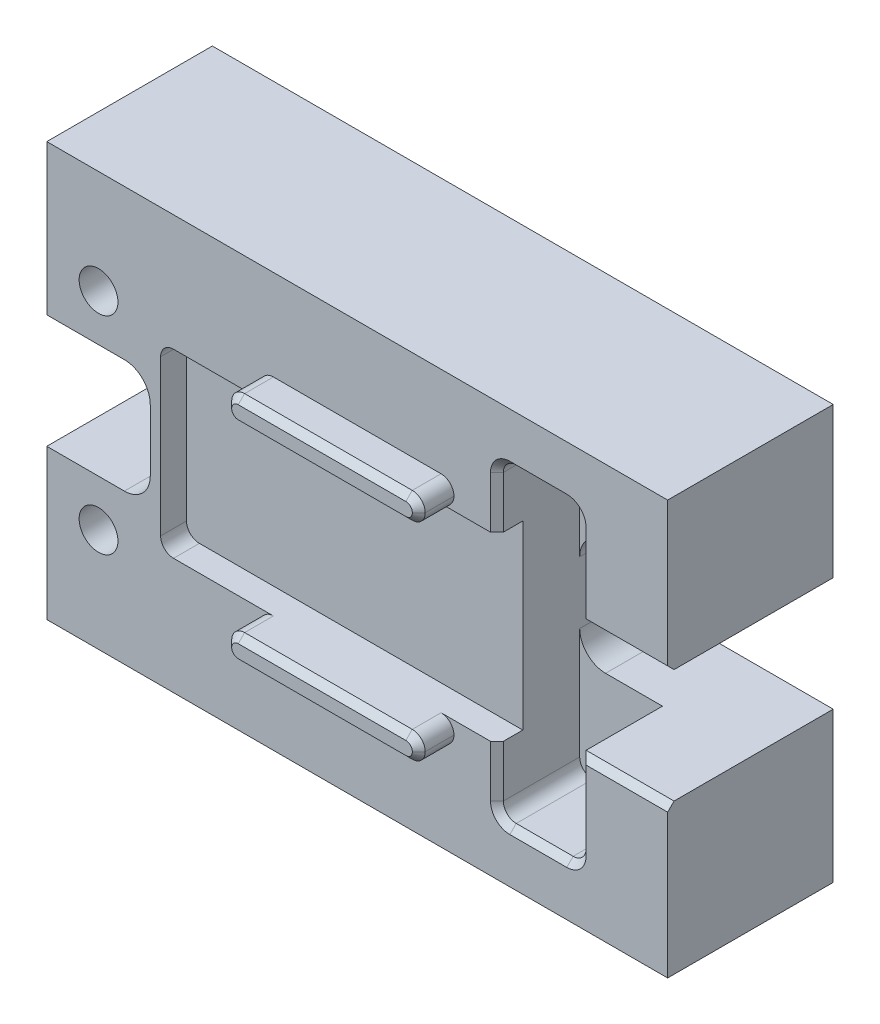
from build123d import *

# Parameters (mm, degrees)
SKETCH1_W           = 50.8
SKETCH1_H           = 76.2
BOSS_EXTRUDE1_DEPTH = 13.97
SKETCH2_W           = 76.2
SKETCH2_H           = 50.8
BOSS_EXTRUDE2_DEPTH = 6.35
CUT_EXTRUDE1_DEPTH  = 10.16
SKETCH4_W           = 12.7
SKETCH4_H           = 13.97
SKETCH4_W_2         = 20.955
CUT_EXTRUDE2_DEPTH  = 51.096630625
SKETCH8_R           = 2.38125
CUT_EXTRUDE4_DEPTH  = 51.096630625
SKETCH10_W          = 23.749
SKETCH10_H          = 3.175
BOSS_EXTRUDE4_DEPTH = 4.318
SKETCH11_W          = 41.275
SKETCH11_H          = 22.225
CUT_EXTRUDE5_DEPTH  = 3.175
FILLET2_R           = 3.175
FILLET3_R           = 1.5875
CHAMFER3_SIZE       = 0.7874


with BuildPart() as part:
    # Sketch1 → Boss-Extrude1 (new body)
    with BuildSketch(Plane(origin=(0, 0, 0), x_dir=(0, 1, 0), z_dir=(0, 0, 1))):
        Rectangle(SKETCH1_W, SKETCH1_H)
    extrude(amount=-BOSS_EXTRUDE1_DEPTH)

    # Sketch2 → Boss-Extrude2 (add)
    with BuildSketch(Plane.XY):
        Rectangle(SKETCH2_W, SKETCH2_H)
    extrude(amount=BOSS_EXTRUDE2_DEPTH)

    # Sketch3 → Cut-Extrude1 (cut)
    with BuildSketch(Plane.XY.offset(6.35)):
        Polygon((38.1, 6.985), (38.1, -6.985), (27.305, -6.985), (27.305, -19.05), (17.145, -19.05), (17.145, 19.05), (27.305, 19.05), (27.305, 6.985), align=None)
    extrude(amount=-CUT_EXTRUDE1_DEPTH, mode=Mode.SUBTRACT)

    # Sketch4 → Cut-Extrude2 (cut, through all)
    with BuildSketch(Plane.XY.offset(6.35)):
        with Locations((-31.75, 0)):
            Rectangle(SKETCH4_W, SKETCH4_H)
        with Locations((27.6225, 0)):
            Rectangle(SKETCH4_W_2, SKETCH4_H)
    extrude(amount=-CUT_EXTRUDE2_DEPTH, mode=Mode.SUBTRACT)

    # Sketch8 → Cut-Extrude4 (cut, through all)
    with BuildSketch(Plane.XY.offset(6.35)):
        with Locations((-31.75, 12.7)):
            Circle(SKETCH8_R)
        with Locations((-31.75, -12.7)):
            Circle(SKETCH8_R)
    extrude(amount=-CUT_EXTRUDE4_DEPTH, mode=Mode.SUBTRACT)

    # Sketch10 → Boss-Extrude4 (add)
    with BuildSketch(Plane.XY.offset(6.35)):
        with Locations((0, 12.7)):
            Rectangle(SKETCH10_W, SKETCH10_H)
    boss_extrude4 = extrude(amount=BOSS_EXTRUDE4_DEPTH)

    # Sketch11 → Cut-Extrude5 (cut)
    with BuildSketch(Plane.XY.offset(6.35)):
        with Locations((-3.4925, 0)):
            Rectangle(SKETCH11_W, SKETCH11_H)
    extrude(amount=-CUT_EXTRUDE5_DEPTH, mode=Mode.SUBTRACT)

    # Mirror1: Boss-Extrude4 across plane
    add(boss_extrude4.mirror(Plane.ZX))

    # Fillet2
    fillet2_edges = [part.edges().sort_by_distance(p)[0] for p in [
        (-25.4, 6.985, -3.81),
        (-25.4, -6.985, -3.81),
        (17.145, -6.985, -8.89),
        (17.145, 6.985, -8.89),
    ]]
    fillet(fillet2_edges, radius=FILLET2_R)

    # Fillet3
    fillet3_edges = [part.edges().sort_by_distance(p)[0] for p in [
        (-24.13, -11.1125, 4.7625),
        (-24.13, 11.1125, 4.7625),
        (17.145, -19.05, 1.27),
        (27.305, -19.05, 1.27),
        (11.8745, 14.2875, 8.509),
        (11.8745, -11.1125, 8.509),
        (11.8745, -14.2875, 8.509),
        (11.8745, 11.1125, 8.509),
        (17.145, 19.05, 1.27),
        (-11.8745, -14.2875, 8.509),
        (-11.8745, -11.1125, 8.509),
        (-11.8745, 11.1125, 8.509),
        (-11.8745, 14.2875, 8.509),
        (27.305, 19.05, 1.27),
    ]]
    fillet(fillet3_edges, radius=FILLET3_R - 0.0001)  # a hair under: the kernel refuses the full size

    # Chamfer3
    chamfer3_edges = [part.edges().sort_by_distance(p)[0] for p in [
        (17.145, -14.28755, 6.35),
        (0, -11.1125, 10.668),
        (0, 11.1125, 10.668),
        (22.225, -19.05, 6.35),
        (17.145, 14.28755, 6.35),
        (27.305, -12.2238, 6.35),
        (0, 14.2875, 10.668),
        (-11.409561304, 13.822561304, 10.668),
        (-11.409561304, 11.577438696, 10.668),
        (11.409561304, 11.577438696, 10.668),
        (11.409561304, 13.822561304, 10.668),
        (0, -14.2875, 10.668),
        (-11.409561304, -11.577438696, 10.668),
        (-11.409561304, -13.822561304, 10.668),
        (11.409561304, -13.822561304, 10.668),
        (11.409561304, -11.577438696, 10.668),
        (22.225, 19.05, 6.35),
        (17.609938696, -18.585061304, 6.35),
        (26.840061304, -18.585061304, 6.35),
        (17.609938696, 18.585061304, 6.35),
        (26.840061304, 18.585061304, 6.35),
        (32.7025, -6.985, 6.35),
        (32.7025, 6.985, 6.35),
        (27.305, 12.2238, 6.35),
    ]]
    chamfer(chamfer3_edges, length=CHAMFER3_SIZE)


solid = part.part
